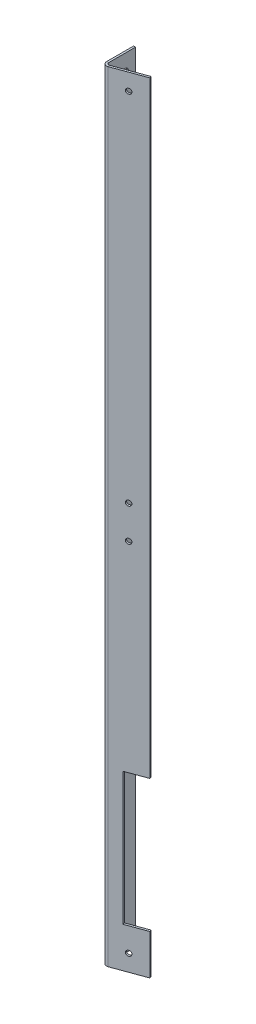
from build123d import *

# Parameters (mm, degrees)
SKETCH1_W                = 600
SKETCH1_H                = 50
BASE_FLANGE1_DEPTH       = 1.5
SKETCHED_START           = -300
SKETCHED_BEND2_DEPTH     = 600
SKETCHED_BEND2_2_DEPTH   = 600
F_4_0_4_DIAMETER_HOLE1_D = 4
F_5_0_5_DIAMETER_HOLE1_D = 5
CUT_EXTRUDE1_REACH       = 304.135
SKETCH11_W               = 102
SKETCH11_H               = 16


# Read off the part's stored shape, not the designer's step: Sketched Bend2
# Sheet-metal steps are written as plain solids
with BuildPart() as part:
    # Sketch1 → Base-Flange1 (new body)
    with BuildSketch(Plane.YZ):
        Rectangle(SKETCH1_W, SKETCH1_H)
    extrude(amount=-BASE_FLANGE1_DEPTH)

    # Sketched Bend2 outline → Sketched Bend2 (cut)
    with BuildSketch(Plane(origin=(0, 0, 0), x_dir=(1, 0, 0), z_dir=(0, 1, 0)).offset(SKETCHED_START)):
        with BuildLine():
            Line((0, -25), (0, 1.686367809))
            ThreePointArc((0, 1.686367809), (-1.098076211, 2.78444402), (-1.5, 4.28444402))
            Line((-1.5, 4.28444402), (-1.5, -25))
            Line((-1.5, -25), (0, -25))
        make_face()
    extrude(amount=SKETCHED_BEND2_DEPTH, mode=Mode.SUBTRACT)

    # Sketched Bend2 2 outline → Sketched Bend2 2 (add)
    with BuildSketch(Plane(origin=(0, 0, 0), x_dir=(1, 0, 0), z_dir=(0, 1, 0)).offset(SKETCHED_START)):
        with BuildLine():
            Line((2.52606043, 1.465366158), (25.985255658, 10.003814941))
            Line((25.985255658, 10.003814941), (25.472225443, 11.413353872))
            Line((25.472225443, 11.413353872), (2.013030215, 2.874905089))
            ThreePointArc((2.013030215, 2.874905089), (0.639635346, 3.055715954), (0, 4.28444402))
            Line((0, 4.28444402), (0, 1.686367809))
            ThreePointArc((0, 1.686367809), (1.238532772, 1.295859926), (2.52606043, 1.465366158))
        make_face()
    extrude(amount=SKETCHED_BEND2_2_DEPTH)

    # Ø4.0 (4) Diameter Hole1 (through all)
    with Locations(Plane(origin=(-0.175466668, 0, -0.482090707), x_dir=(0, -1, 0), z_dir=(0.3420201433256727, 0, 0.9396926207859071))):
        with Locations((287.3, 15.139659211), (12.7, 15.139659211)):
            f_4_0_4_diameter_hole1 = Hole(F_4_0_4_DIAMETER_HOLE1_D / 2)

    # Mirror1: Ø4.0 (4) Diameter Hole1 across plane
    add(f_4_0_4_diameter_hole1.mirror(Plane.ZX), mode=Mode.SUBTRACT)

    # Ø5.0 (5) Diameter Hole1 (through all)
    with Locations(Plane(origin=(-1.5, 0, 0), x_dir=(0, -1, 0), z_dir=(-1, 0, 0))):
        with Locations((-287.3, -16.98444402), (-87.3, -16.98444402), (87.3, -16.98444402), (287.3, -16.98444402)):
            Hole(F_5_0_5_DIAMETER_HOLE1_D / 2)

    # Sketch11 → Cut-Extrude1 (cut, up to next)
    with BuildSketch(Plane(origin=(-0.175466668, 0, -0.482090707), x_dir=(0, -1, 0), z_dir=(0.3420201433256727, 0, 0.9396926207859071)), mode=Mode.PRIVATE) as cut_extrude1_sk1:
        with Locations((218, 19.839659211)):
            Rectangle(SKETCH11_W, SKETCH11_H)
    cut_extrude1_tool1 = extrude(cut_extrude1_sk1.sketch, amount=-CUT_EXTRUDE1_REACH, mode=Mode.PRIVATE) & part.part
    add(cut_extrude1_tool1.solids().sort_by_distance((18.467715, -218, -7.267654))[0], mode=Mode.SUBTRACT)


solid = part.part
